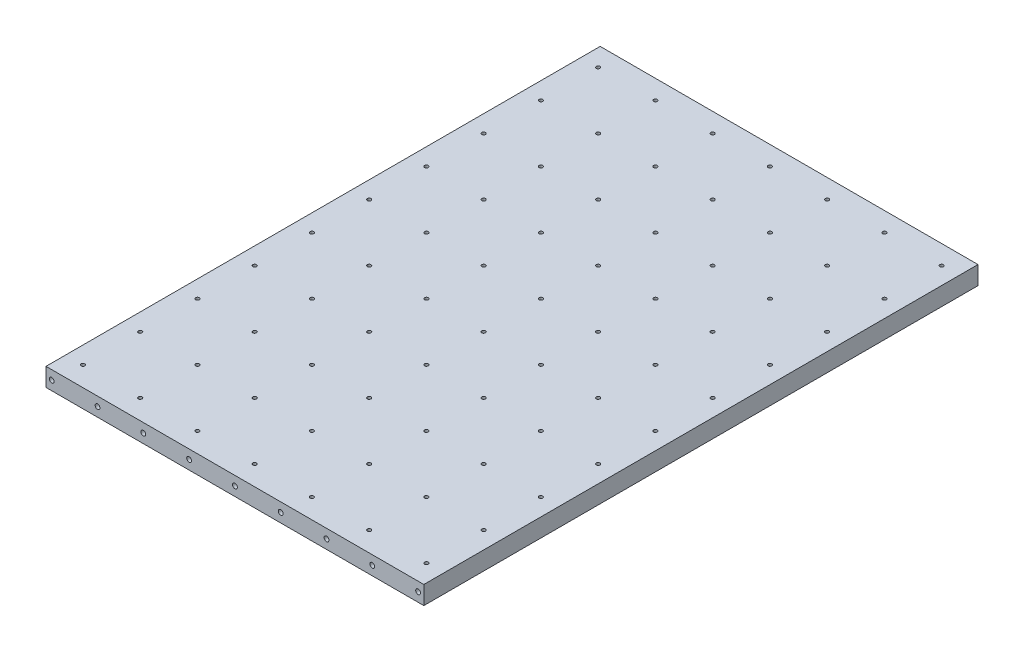
from build123d import *
from OCP.BRepAlgoAPI import BRepAlgoAPI_Cut
from OCP.TopTools import TopTools_ListOfShape

# Parameters (mm, degrees)
SKETCH1_W                = 330
SKETCH1_H                = 16
SKETCH1_R                = 2.1
BOSS_EXTRUDE1_DEPTH      = 484
CUT_EXTRUDE1_START       = -9
CUT_EXTRUDE1_OUTLINE_R   = 1.6
CUT_EXTRUDE1_DEPTH       = 18
CUT_EXTRUDE1_START_2     = 1.360148495
CUT_EXTRUDE1_2_OUTLINE_R = 1.6
CUT_EXTRUDE1_2_DEPTH     = 7.639851505


with BuildPart() as part:
    # Sketch1 → Boss-Extrude1 (new body)
    with BuildSketch(Plane.XY):
        Rectangle(SKETCH1_W, SKETCH1_H)
        Circle(SKETCH1_R, mode=Mode.SUBTRACT)
        with Locations((40, 0)):
            Circle(SKETCH1_R, mode=Mode.SUBTRACT)
        with Locations((80, 0)):
            Circle(SKETCH1_R, mode=Mode.SUBTRACT)
        with Locations((120, 0)):
            Circle(SKETCH1_R, mode=Mode.SUBTRACT)
        with Locations((160, 0)):
            Circle(SKETCH1_R, mode=Mode.SUBTRACT)
        with Locations((-40, 0)):
            Circle(SKETCH1_R, mode=Mode.SUBTRACT)
        with Locations((-80, 0)):
            Circle(SKETCH1_R, mode=Mode.SUBTRACT)
        with Locations((-120, 0)):
            Circle(SKETCH1_R, mode=Mode.SUBTRACT)
        with Locations((-160, 0)):
            Circle(SKETCH1_R, mode=Mode.SUBTRACT)
    extrude(amount=BOSS_EXTRUDE1_DEPTH)


with BuildPart() as cut_extrude1_tool:
    # Cut-Extrude1: read off the stored shape, not the designer's step
    # Cut-Extrude1 outline → Cut-Extrude1 (new body)
    with BuildSketch(Plane(origin=(0, 0, 0), x_dir=(1, 0, 0), z_dir=(0, 1, 0)).offset(CUT_EXTRUDE1_START)):
        with Locations((-150, -466.745725643)):
            Circle(CUT_EXTRUDE1_OUTLINE_R)
        with Locations((-100, -466.745725643)):
            Circle(CUT_EXTRUDE1_OUTLINE_R)
        with Locations((-50, -466.745725643)):
            Circle(CUT_EXTRUDE1_OUTLINE_R)
        with Locations((50, -466.745725643)):
            Circle(CUT_EXTRUDE1_OUTLINE_R)
        with Locations((100, -466.745725643)):
            Circle(CUT_EXTRUDE1_OUTLINE_R)
        with Locations((150, -466.745725643)):
            Circle(CUT_EXTRUDE1_OUTLINE_R)
        with Locations((-100, -416.745725643)):
            Circle(CUT_EXTRUDE1_OUTLINE_R)
        with Locations((-50, -416.745725643)):
            Circle(CUT_EXTRUDE1_OUTLINE_R)
        with Locations((50, -416.745725643)):
            Circle(CUT_EXTRUDE1_OUTLINE_R)
        with Locations((100, -416.745725643)):
            Circle(CUT_EXTRUDE1_OUTLINE_R)
        with Locations((150, -416.745725643)):
            Circle(CUT_EXTRUDE1_OUTLINE_R)
        with Locations((-100, -366.745725643)):
            Circle(CUT_EXTRUDE1_OUTLINE_R)
        with Locations((-50, -366.745725643)):
            Circle(CUT_EXTRUDE1_OUTLINE_R)
        with Locations((50, -366.745725643)):
            Circle(CUT_EXTRUDE1_OUTLINE_R)
        with Locations((100, -366.745725643)):
            Circle(CUT_EXTRUDE1_OUTLINE_R)
        with Locations((150, -366.745725643)):
            Circle(CUT_EXTRUDE1_OUTLINE_R)
        with Locations((-100, -316.745725643)):
            Circle(CUT_EXTRUDE1_OUTLINE_R)
        with Locations((-50, -316.745725643)):
            Circle(CUT_EXTRUDE1_OUTLINE_R)
        with Locations((50, -316.745725643)):
            Circle(CUT_EXTRUDE1_OUTLINE_R)
        with Locations((100, -316.745725643)):
            Circle(CUT_EXTRUDE1_OUTLINE_R)
        with Locations((150, -316.745725643)):
            Circle(CUT_EXTRUDE1_OUTLINE_R)
        with Locations((-100, -266.745725643)):
            Circle(CUT_EXTRUDE1_OUTLINE_R)
        with Locations((-50, -266.745725643)):
            Circle(CUT_EXTRUDE1_OUTLINE_R)
        with Locations((50, -266.745725643)):
            Circle(CUT_EXTRUDE1_OUTLINE_R)
        with Locations((100, -266.745725643)):
            Circle(CUT_EXTRUDE1_OUTLINE_R)
        with Locations((150, -266.745725643)):
            Circle(CUT_EXTRUDE1_OUTLINE_R)
        with Locations((-100, -216.745725643)):
            Circle(CUT_EXTRUDE1_OUTLINE_R)
        with Locations((-50, -216.745725643)):
            Circle(CUT_EXTRUDE1_OUTLINE_R)
        with Locations((50, -216.745725643)):
            Circle(CUT_EXTRUDE1_OUTLINE_R)
        with Locations((100, -216.745725643)):
            Circle(CUT_EXTRUDE1_OUTLINE_R)
        with Locations((150, -216.745725643)):
            Circle(CUT_EXTRUDE1_OUTLINE_R)
        with Locations((-100, -166.745725643)):
            Circle(CUT_EXTRUDE1_OUTLINE_R)
        with Locations((-50, -166.745725643)):
            Circle(CUT_EXTRUDE1_OUTLINE_R)
        with Locations((50, -166.745725643)):
            Circle(CUT_EXTRUDE1_OUTLINE_R)
        with Locations((100, -166.745725643)):
            Circle(CUT_EXTRUDE1_OUTLINE_R)
        with Locations((150, -166.745725643)):
            Circle(CUT_EXTRUDE1_OUTLINE_R)
        with Locations((-100, -116.745725643)):
            Circle(CUT_EXTRUDE1_OUTLINE_R)
        with Locations((-50, -116.745725643)):
            Circle(CUT_EXTRUDE1_OUTLINE_R)
        with Locations((50, -116.745725643)):
            Circle(CUT_EXTRUDE1_OUTLINE_R)
        with Locations((100, -116.745725643)):
            Circle(CUT_EXTRUDE1_OUTLINE_R)
        with Locations((150, -116.745725643)):
            Circle(CUT_EXTRUDE1_OUTLINE_R)
        with Locations((-100, -66.745725643)):
            Circle(CUT_EXTRUDE1_OUTLINE_R)
        with Locations((-50, -66.745725643)):
            Circle(CUT_EXTRUDE1_OUTLINE_R)
        with Locations((50, -66.745725643)):
            Circle(CUT_EXTRUDE1_OUTLINE_R)
        with Locations((100, -66.745725643)):
            Circle(CUT_EXTRUDE1_OUTLINE_R)
        with Locations((150, -66.745725643)):
            Circle(CUT_EXTRUDE1_OUTLINE_R)
        with Locations((-100, -16.745725643)):
            Circle(CUT_EXTRUDE1_OUTLINE_R)
        with Locations((-50, -16.745725643)):
            Circle(CUT_EXTRUDE1_OUTLINE_R)
        with Locations((50, -16.745725643)):
            Circle(CUT_EXTRUDE1_OUTLINE_R)
        with Locations((100, -16.745725643)):
            Circle(CUT_EXTRUDE1_OUTLINE_R)
        with Locations((150, -16.745725643)):
            Circle(CUT_EXTRUDE1_OUTLINE_R)
        with Locations((-150, -416.745725643)):
            Circle(CUT_EXTRUDE1_OUTLINE_R)
        with Locations((-150, -366.745725643)):
            Circle(CUT_EXTRUDE1_OUTLINE_R)
        with Locations((-150, -316.745725643)):
            Circle(CUT_EXTRUDE1_OUTLINE_R)
        with Locations((-150, -266.745725643)):
            Circle(CUT_EXTRUDE1_OUTLINE_R)
        with Locations((-150, -216.745725643)):
            Circle(CUT_EXTRUDE1_OUTLINE_R)
        with Locations((-150, -166.745725643)):
            Circle(CUT_EXTRUDE1_OUTLINE_R)
        with Locations((-150, -116.745725643)):
            Circle(CUT_EXTRUDE1_OUTLINE_R)
        with Locations((-150, -66.745725643)):
            Circle(CUT_EXTRUDE1_OUTLINE_R)
        with Locations((-150, -16.745725643)):
            Circle(CUT_EXTRUDE1_OUTLINE_R)
    extrude(amount=CUT_EXTRUDE1_DEPTH)


with BuildPart() as part_1:
    add(part.part)

    # Cut-Extrude1: cut by cut_extrude1_tool, with a tolerance
    cut_extrude1_stock = TopTools_ListOfShape()
    cut_extrude1_stock.Append(part_1.part.wrapped)
    cut_extrude1_tools = TopTools_ListOfShape()
    cut_extrude1_tools.Append(cut_extrude1_tool.part.wrapped)
    cut_extrude1_cut = BRepAlgoAPI_Cut()
    cut_extrude1_cut.SetArguments(cut_extrude1_stock)
    cut_extrude1_cut.SetTools(cut_extrude1_tools)
    cut_extrude1_cut.SetFuzzyValue(0.00001)
    cut_extrude1_cut.Build()
    add(Compound.cast(cut_extrude1_cut.Shape()).solids(), mode=Mode.REPLACE)


with BuildPart() as cut_extrude1_2_tool:
    # Cut-Extrude1 2 outline → Cut-Extrude1 2 (new body)
    with BuildSketch(Plane(origin=(0, 0, 0), x_dir=(1, 0, 0), z_dir=(0, 1, 0)).offset(CUT_EXTRUDE1_START_2)):
        with Locations((0, -466.745725643)):
            Circle(CUT_EXTRUDE1_2_OUTLINE_R)
        with Locations((0, -416.745725643)):
            Circle(CUT_EXTRUDE1_2_OUTLINE_R)
        with Locations((0, -366.745725643)):
            Circle(CUT_EXTRUDE1_2_OUTLINE_R)
        with Locations((0, -316.745725643)):
            Circle(CUT_EXTRUDE1_2_OUTLINE_R)
        with Locations((0, -266.745725643)):
            Circle(CUT_EXTRUDE1_2_OUTLINE_R)
        with Locations((0, -216.745725643)):
            Circle(CUT_EXTRUDE1_2_OUTLINE_R)
        with Locations((0, -166.745725643)):
            Circle(CUT_EXTRUDE1_2_OUTLINE_R)
        with Locations((0, -116.745725643)):
            Circle(CUT_EXTRUDE1_2_OUTLINE_R)
        with Locations((0, -66.745725643)):
            Circle(CUT_EXTRUDE1_2_OUTLINE_R)
        with Locations((0, -16.745725643)):
            Circle(CUT_EXTRUDE1_2_OUTLINE_R)
    extrude(amount=CUT_EXTRUDE1_2_DEPTH)


with BuildPart() as part_2:
    add(part_1.part)

    # Cut-Extrude1 2: cut by cut_extrude1_2_tool, with a tolerance
    cut_extrude1_2_stock = TopTools_ListOfShape()
    cut_extrude1_2_stock.Append(part_2.part.wrapped)
    cut_extrude1_2_tools = TopTools_ListOfShape()
    cut_extrude1_2_tools.Append(cut_extrude1_2_tool.part.wrapped)
    cut_extrude1_2_cut = BRepAlgoAPI_Cut()
    cut_extrude1_2_cut.SetArguments(cut_extrude1_2_stock)
    cut_extrude1_2_cut.SetTools(cut_extrude1_2_tools)
    cut_extrude1_2_cut.SetFuzzyValue(0.00001)
    cut_extrude1_2_cut.Build()
    add(Compound.cast(cut_extrude1_2_cut.Shape()).solids(), mode=Mode.REPLACE)


solid = part_2.part
